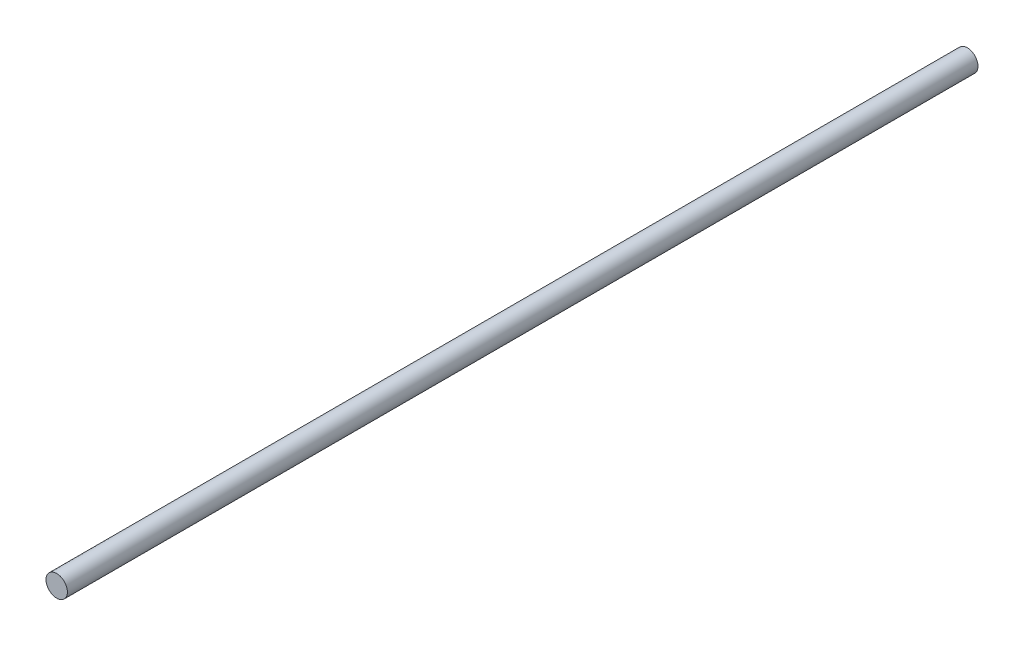
from build123d import *

# Parameters (mm, degrees)
ESBO_O1_R                = 4
RESSALTO_EXTRUS_O1_DEPTH = 340


with BuildPart() as part:
    # Esboço1 → Ressalto-extrusão1 (new body)
    with BuildSketch(Plane.XY):
        Circle(ESBO_O1_R)
    extrude(amount=RESSALTO_EXTRUS_O1_DEPTH)


solid = part.part
